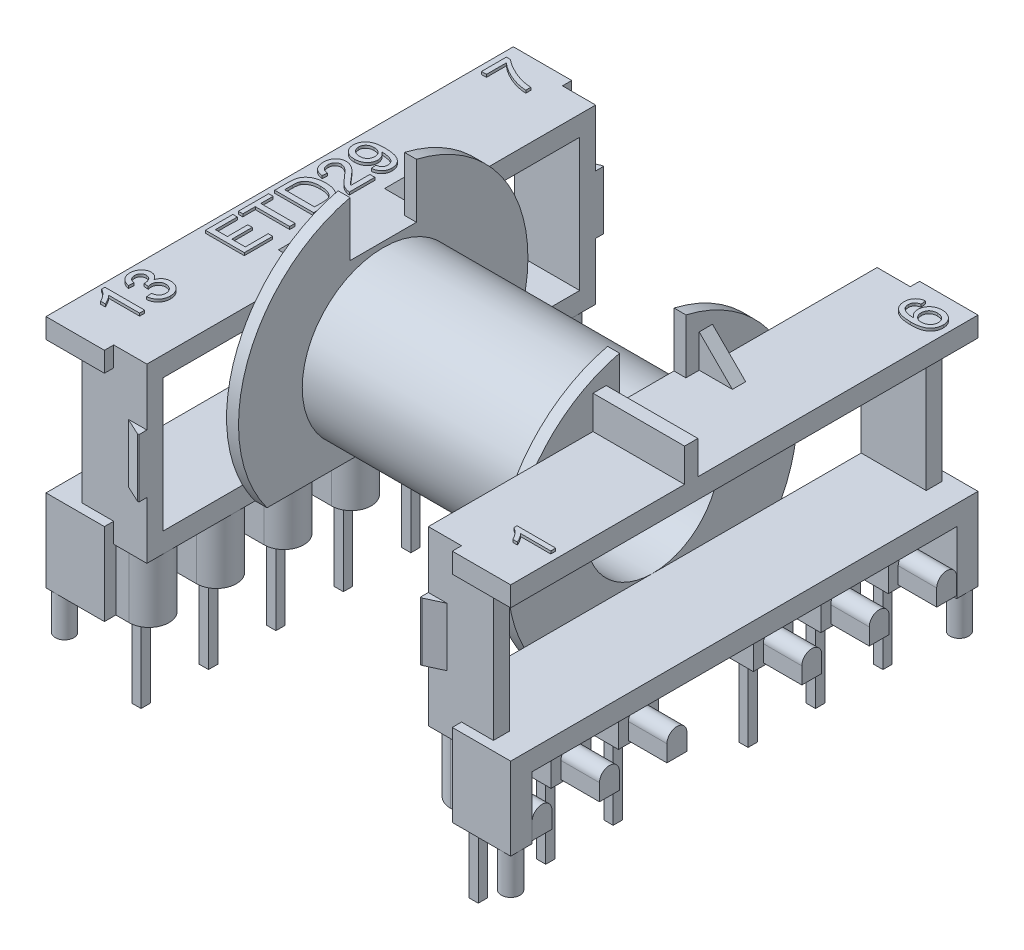
from build123d import *

# Parameters (mm, degrees)
BOSS_EXTRUDE1_DEPTH       = 6.9
SKETCH3_W                 = 17.6
SKETCH3_H                 = 1.5
BOSS_EXTRUDE2_DEPTH       = 4.4
SKETCH21_W                = 4.4
SKETCH21_H                = 1.6
BOSS_EXTRUDE17_DEPTH      = 4.7
SKETCH4_R                 = 0.7
BOSS_EXTRUDE3_DEPTH       = 2.9
SKETCH5_W                 = 1.4
SKETCH5_H                 = 4.4
BOSS_EXTRUDE4_DEPTH       = 0.6
CHAMFER1_SIZE2            = 1.286704152
CHAMFER1_SIZE             = 0.6
CHAMFER1_OF_MIRROR1_SIZE2 = 1.286704152
CHAMFER1_OF_MIRROR1_SIZE  = 0.6
CUT_EXTRUDE1_DEPTH        = 31.951736623
BOSS_EXTRUDE18_DEPTH      = 4.7
SKETCH23_W                = 0.7
SKETCH23_H                = 0.7
PIN_DEPTH                 = 6.3
BOSS_EXTRUDE20_DEPTH      = 2.9
LPATTERN1_COUNT           = 7
LPATTERN1_PITCH           = 5.08
SKETCH11_W                = 1
SKETCH11_H                = 2.5
BOSS_EXTRUDE9_DEPTH       = 2.5
CHAMFER3_SIZE             = 2.5
SKETCH12_W                = 1
SKETCH12_H                = 2.5
BOSS_EXTRUDE10_DEPTH      = 6.9
NO1_DEPTH                 = 0.2
NO6_DEPTH                 = 0.2
NO13_DEPTH                = 0.2
NO7_DEPTH                 = 0.2
ETD29_DEPTH               = 0.2
SKETCH19_W                = 2
SKETCH19_H                = 10
CUT_EXTRUDE2_DEPTH        = 25
SKETCH25_W                = 4.7
SKETCH25_H                = 11.1
CUT_EXTRUDE3_DEPTH        = 18


# Read off the part's stored shape, not the designer's step: Mirror2
with BuildPart() as part:
    # Sketch1 → Base-Revolve (revolve)
    with BuildSketch(Plane.ZX, mode=Mode.PRIVATE) as base_revolve_sk:
        Polygon((6.1, -9.7), (6.1, 9.7), (10.9, 9.7), (10.9, 10.6), (5, 10.6), (5, -10.6), (10.9, -10.6), (10.9, -9.7), align=None)
    revolve(base_revolve_sk.sketch.rotate(Axis((25, 0, 0), (-1, 0, 0)), 180), axis=Axis((25, 0, 0), (-1, 0, 0)))

    # Sketch2 → Boss-Extrude1 (add)
    with BuildSketch(Plane.ZY.offset(-10.6)):
        Polygon((0, -6.5), (0, -5), (-15.7, -5), (-15.7, 5), (0, 5), (0, 6.5), (-16.9, 6.5), (-16.9, -6.5), align=None)
    boss_extrude1 = extrude(amount=-BOSS_EXTRUDE1_DEPTH)

    # Sketch3 → Boss-Extrude2 (add)
    with BuildSketch(Plane(origin=(17.5, 0, 0), x_dir=(0, 0, -1), z_dir=(1, 0, 0))):
        with Locations((8.8, 5.75)):
            Rectangle(SKETCH3_W, SKETCH3_H)
        with Locations((8.8, -5.75)):
            Rectangle(SKETCH3_W, SKETCH3_H)
    boss_extrude2 = extrude(amount=-BOSS_EXTRUDE2_DEPTH)

    # Sketch21 → Boss-Extrude17 (add)
    with BuildSketch(Plane.XZ.offset(6.5)):
        with Locations((15.3, -16.8)):
            Rectangle(SKETCH21_W, SKETCH21_H)
    boss_extrude17 = extrude(amount=BOSS_EXTRUDE17_DEPTH)

    # Sketch4 → Boss-Extrude3 (add)
    with BuildSketch(Plane.XZ.offset(11.2)):
        with Locations(Location((16.8, -16.9, 0), (0, 0, 270))):
            Circle(SKETCH4_R)
    boss_extrude3 = extrude(amount=BOSS_EXTRUDE3_DEPTH)

    # Sketch5 → Boss-Extrude4 (add)
    with BuildSketch(Plane(origin=(0, 0, -16.9), x_dir=(-1, 0, 0), z_dir=(0, 0, -1))):
        with Locations((-11.3, 0)):
            Rectangle(SKETCH5_W, SKETCH5_H)
    boss_extrude4 = extrude(amount=BOSS_EXTRUDE4_DEPTH)

    # Chamfer1
    chamfer1_edges = [part.edges().sort_by_distance(p)[0] for p in [
        (12, 0, -17.5),
    ]]
    chamfer1_side = [part.faces().sort_by_distance(p)[0] for p in [
        (12, 0, -17.488),
    ]]
    chamfer(chamfer1_edges, length=CHAMFER1_SIZE - 0.0001, length2=CHAMFER1_SIZE2 - 0.0001, reference=chamfer1_side[0])  # a hair under: the kernel refuses the full size

    # Mirror1: Boss-Extrude1, Boss-Extrude2, Boss-Extrude17, Boss-Extrude3, Boss-Extrude4 across plane
    add(boss_extrude1.mirror(Plane.XY))
    add(boss_extrude2.mirror(Plane.XY))
    add(boss_extrude17.mirror(Plane.XY))
    add(boss_extrude3.mirror(Plane.XY))
    add(boss_extrude4.mirror(Plane.XY))

    # Chamfer1 of Mirror1
    chamfer1_of_mirror1_edges = [part.edges().sort_by_distance(p)[0] for p in [
        (12, 0, 17.5),
    ]]
    chamfer1_of_mirror1_side = [part.faces().sort_by_distance(p)[0] for p in [
        (12, 0, 17.488),
    ]]
    chamfer(chamfer1_of_mirror1_edges, length=CHAMFER1_OF_MIRROR1_SIZE - 0.0001, length2=CHAMFER1_OF_MIRROR1_SIZE2 - 0.0001, reference=chamfer1_of_mirror1_side[0])  # a hair under: the kernel refuses the full size

    # Sketch6 → Cut-Extrude1 (cut, through all)
    with BuildSketch(Plane(origin=(10.6, 0, 0), x_dir=(0, 0, -1), z_dir=(1, 0, 0))):
        with BuildLine():
            Line((-2.5, 10.609429768), (-2.5, 6.5))
            Line((-2.5, 6.5), (2.5, 6.5))
            Line((2.5, 6.5), (2.5, 10.609429768))
            ThreePointArc((2.5, 10.609429768), (0, 10.9), (-2.5, 10.609429768))
        make_face()
        with BuildLine():
            Line((8.749857142, -6.5), (-8.749857142, -6.5))
            ThreePointArc((-8.749857142, -6.5), (0, -10.9), (8.749857142, -6.5))
        make_face()
    extrude(amount=-CUT_EXTRUDE1_DEPTH, mode=Mode.SUBTRACT)

    # Sketch22 → Boss-Extrude18 (add)
    with BuildSketch(Plane.XZ.offset(6.5)):
        with BuildLine():
            Line((12.1, 13.74), (14.6, 13.74))
            Line((14.6, 13.74), (14.6, 16.74))
            Line((14.6, 16.74), (12.1, 16.74))
            ThreePointArc((12.1, 16.74), (10.6, 15.24), (12.1, 13.74))
        make_face()
    boss_extrude18 = extrude(amount=BOSS_EXTRUDE18_DEPTH)

    # Sketch23 → Pin (add)
    with BuildSketch(Plane.XZ.offset(11.2)):
        with Locations((12.7, 15.24)):
            Rectangle(SKETCH23_W, SKETCH23_H)
    pin = extrude(amount=PIN_DEPTH)

    # Sketch24 → Boss-Extrude20 (add)
    with BuildSketch(Plane(origin=(14.6, 0, 0), x_dir=(0, 0, -1), z_dir=(1, 0, 0))):
        with BuildLine():
            Line((-15.99, -11), (-14.49, -11))
            Line((-14.49, -11), (-14.49, -9.75))
            ThreePointArc((-14.49, -9.75), (-15.24, -9), (-15.99, -9.75))
            Line((-15.99, -9.75), (-15.99, -11))
        make_face()
    boss_extrude20 = extrude(amount=BOSS_EXTRUDE20_DEPTH)

    # LPattern1: Boss-Extrude18, Pin, Boss-Extrude20 ×7
    with Locations(*[(0, 0, -i * LPATTERN1_PITCH) for i in range(1, LPATTERN1_COUNT)]):
        add(boss_extrude18)
        add(pin)
        add(boss_extrude20)

    # Sketch11 → Boss-Extrude9 (add)
    with BuildSketch(Plane(origin=(10.6, 0, 0), x_dir=(0, 0, -1), z_dir=(1, 0, 0))):
        with Locations((-4, 7.75)):
            Rectangle(SKETCH11_W, SKETCH11_H)
        with Locations((4, 7.75)):
            Rectangle(SKETCH11_W, SKETCH11_H)
    extrude(amount=BOSS_EXTRUDE9_DEPTH)

    # Chamfer3
    chamfer3_edges = [part.edges().sort_by_distance(p)[0] for p in [
        (13.1, 9, -4),
        (13.1, 9, 4),
    ]]
    chamfer(chamfer3_edges, length=CHAMFER3_SIZE - 0.0001)  # a hair under: the kernel refuses the full size

    # Mirror2: part across plane


with BuildPart() as part_1:
    add(part.part)
    add(part.part.mirror(Plane(origin=(0, 0, 0), x_dir=(0, 0, 1), z_dir=(1, 0, 0))))

    # Sketch12 → Boss-Extrude10 (add)
    with BuildSketch(Plane(origin=(10.6, 0, 0), x_dir=(0, 0, -1), z_dir=(1, 0, 0))):
        with Locations((-4, 7.75)):
            Rectangle(SKETCH12_W, SKETCH12_H)
    extrude(amount=BOSS_EXTRUDE10_DEPTH)

    # Sketch13 → No1 (add)
    with BuildSketch(Plane(origin=(32, 6.5, -1), x_dir=(0, 0, -1), z_dir=(0, 1, 0))):
        with BuildLine():
            Line((-14.705735602, 15), (-15.079301701, 15))
            Line((-15.079301701, 15), (-15.079301701, 17.270581449))
            add(Edge.make_bspline(
                [(-15.079301701, 17.270581449), (-15.10081167, 17.24983773), (-15.145517784, 17.206724184), (-15.221088746, 17.14570775), (-15.305435597, 17.083865008), (-15.397463041, 17.024396298), (-15.491269451, 16.968412921), (-15.581921269, 16.91806448), (-15.667905025, 16.875457483), (-15.724542989, 16.852159809), (-15.751720681, 16.840980434)],
                knots=[0, 0, 0, 0, 0.893362401, 1.856755847, 2.901947673, 4.020460078, 5.132200827, 6.168787962, 7.121294059, 8, 8, 8, 8], degree=3))
            Line((-15.751720681, 16.840980434), (-15.751720681, 17.185361682))
            add(Edge.make_bspline(
                [(-15.751720681, 17.185361682), (-15.705040187, 17.20940223), (-15.613035698, 17.256784726), (-15.483053251, 17.33862081), (-15.361700653, 17.427334494), (-15.250986772, 17.522906137), (-15.151738833, 17.620597512), (-15.068101153, 17.719171947), (-14.998118465, 17.815016128), (-14.963006824, 17.881856816), (-14.946218778, 17.913815576)],
                knots=[0, 0, 0, 0, 1.141258006, 2.249351951, 3.335817539, 4.406819942, 5.426913362, 6.360259544, 7.215985427, 8, 8, 8, 8], degree=3))
            Line((-14.946218778, 17.913815576), (-14.705735602, 17.913815576))
            Line((-14.705735602, 17.913815576), (-14.705735602, 15))
        make_face()
    extrude(amount=NO1_DEPTH)

    # Sketch14 → No6 (add)
    with BuildSketch(Plane(origin=(6, 6.5, -31), x_dir=(0, 0, -1), z_dir=(0, 1, 0))):
        with BuildLine():
            Line((-14.656371262, -8.804991356), (-15.034821028, -8.842836332))
            add(Edge.make_bspline(
                [(-15.034821028, -8.842836332), (-15.04298767, -8.810287633), (-15.058360116, -8.749019717), (-15.09059599, -8.665919031), (-15.126119237, -8.595629985), (-15.156981217, -8.557781274), (-15.171417741, -8.540076519)],
                knots=[0, 0, 0, 0, 1.199207122, 2.257322842, 3.184815751, 4, 4, 4, 4], degree=3))
            add(Edge.make_bspline(
                [(-15.171417741, -8.540076519), (-15.183809818, -8.528000904), (-15.208182164, -8.504250964), (-15.248192685, -8.473292748), (-15.290370398, -8.447063394), (-15.334842779, -8.425813641), (-15.381369569, -8.409027556), (-15.430143492, -8.397284795), (-15.481054055, -8.39001536), (-15.515743245, -8.389139938), (-15.53331033, -8.388696613)],
                knots=[0, 0, 0, 0, 1.028360939, 2.022547923, 3.001693811, 3.976902288, 4.948369586, 5.937776631, 6.955661634, 8, 8, 8, 8], degree=3))
            add(Edge.make_bspline(
                [(-15.53331033, -8.388696613), (-15.561789596, -8.38961361), (-15.618063383, -8.391425556), (-15.700627087, -8.409164371), (-15.780819651, -8.435713338), (-15.830501908, -8.462626189), (-15.855583959, -8.476213121)],
                knots=[0, 0, 0, 0, 1.010336883, 1.996381556, 2.988474728, 4, 4, 4, 4], degree=3))
            add(Edge.make_bspline(
                [(-15.855583959, -8.476213121), (-15.880250599, -8.49665007), (-15.930885311, -8.538602237), (-15.996964233, -8.616121053), (-16.056057743, -8.706376104), (-16.099640272, -8.790636069), (-16.13031227, -8.866182536), (-16.15014925, -8.930928157), (-16.167097482, -9.002458747), (-16.181216316, -9.08063953), (-16.192136325, -9.165533923), (-16.201263266, -9.257195845), (-16.206311239, -9.355857703), (-16.207435557, -9.423909454), (-16.208015304, -9.458999858)],
                knots=[0, 0, 0, 0, 1.063306303, 2.18271343, 3.369442992, 4.644240368, 5.329284104, 6.077448525, 6.892756613, 7.771869145, 8.717113863, 9.73749892, 10.833357348, 12, 12, 12, 12], degree=3))
            add(Edge.make_bspline(
                [(-16.208015304, -9.458999858), (-16.18570318, -9.427651992), (-16.142025836, -9.366286631), (-16.0649757, -9.286016185), (-15.98084051, -9.218162184), (-15.889526201, -9.163985311), (-15.793415446, -9.121996891), (-15.694627607, -9.091782446), (-15.593335819, -9.073236019), (-15.525108986, -9.071021778), (-15.490734731, -9.069906192)],
                knots=[0, 0, 0, 0, 1.083917396, 2.121834425, 3.126226247, 4.123362703, 5.106535049, 6.077135049, 7.031216202, 8, 8, 8, 8], degree=3))
            add(Edge.make_bspline(
                [(-15.490734731, -9.069906192), (-15.461130074, -9.070702712), (-15.402640445, -9.072276389), (-15.316507841, -9.084747048), (-15.233932064, -9.106559089), (-15.154197506, -9.134974282), (-15.078836413, -9.173772302), (-15.006009541, -9.219115763), (-14.937403567, -9.274293554), (-14.872150211, -9.336292091), (-14.812739569, -9.405220675), (-14.760156937, -9.479407459), (-14.716337955, -9.559030262), (-14.680805828, -9.643555841), (-14.652995729, -9.732676624), (-14.63278839, -9.82664569), (-14.620959283, -9.925648763), (-14.619348151, -9.993331227), (-14.618526285, -10.027857163)],
                knots=[0, 0, 0, 0, 0.981553735, 1.939246043, 2.877808487, 3.810434071, 4.740031046, 5.683044261, 6.650811044, 7.654063953, 8.664382933, 9.663624521, 10.66421212, 11.671863278, 12.699354266, 13.755775259, 14.855184124, 16, 16, 16, 16], degree=3))
            add(Edge.make_bspline(
                [(-14.618526285, -10.027857163), (-14.619998776, -10.073485852), (-14.6229047, -10.163532976), (-14.646229292, -10.296139402), (-14.683813403, -10.423959179), (-14.728773513, -10.525181362), (-14.770080118, -10.60272837), (-14.805154258, -10.656968188), (-14.842658407, -10.707939954), (-14.881882169, -10.756345075), (-14.925670473, -10.799968136), (-14.971368624, -10.840864629), (-15.020487116, -10.877620652), (-15.071581322, -10.911459198), (-15.125616447, -10.940800669), (-15.181020214, -10.966873737), (-15.238248698, -10.989083195), (-15.297486686, -11.006521369), (-15.358430791, -11.020948324), (-15.42128386, -11.030868187), (-15.485880476, -11.036986018), (-15.529551434, -11.03755644), (-15.55164149, -11.037844977)],
                knots=[0, 0, 0, 0, 1.777979151, 3.508799182, 5.232661887, 6.960203328, 7.816385973, 8.656273476, 9.47551652, 10.283326439, 11.082130802, 11.882412381, 12.672407567, 13.471692325, 14.269609044, 15.067192643, 15.857822979, 16.66013129, 17.472860815, 18.297850482, 19.139002666, 20, 20, 20, 20], degree=3))
            add(Edge.make_bspline(
                [(-15.55164149, -11.037844977), (-15.588947463, -11.036810462), (-15.662111035, -11.034781597), (-15.769196625, -11.019194938), (-15.870879076, -10.993147441), (-15.967374683, -10.956730095), (-16.058977403, -10.910753943), (-16.144784509, -10.853119667), (-16.225270798, -10.785536212), (-16.300498318, -10.70761162), (-16.368707044, -10.617632154), (-16.427001294, -10.51376824), (-16.47667317, -10.396929045), (-16.517325277, -10.266793109), (-16.548087187, -10.123224341), (-16.57023706, -9.966531083), (-16.583858985, -9.796690891), (-16.585576067, -9.679000268), (-16.58646507, -9.618067025)],
                knots=[0, 0, 0, 0, 0.898506621, 1.76212948, 2.600594211, 3.422599815, 4.24233914, 5.064166416, 5.906856258, 6.769969817, 7.668413694, 8.619051846, 9.63165591, 10.722000005, 11.898403521, 13.164960021, 14.532183992, 16, 16, 16, 16], degree=3))
            add(Edge.make_bspline(
                [(-16.58646507, -9.618067025), (-16.586317661, -9.583369672), (-16.58602692, -9.514934631), (-16.581354966, -9.414215309), (-16.575995658, -9.316946457), (-16.56681333, -9.223516135), (-16.55597141, -9.133504123), (-16.541421697, -9.047439758), (-16.525797059, -8.964654083), (-16.506800687, -8.885798892), (-16.485624377, -8.810132362), (-16.461249706, -8.738485906), (-16.435504017, -8.669932543), (-16.406296067, -8.605553702), (-16.375167197, -8.544300871), (-16.340758789, -8.487307552), (-16.304673717, -8.433270574), (-16.278034217, -8.399949678), (-16.264782769, -8.383374663)],
                knots=[0, 0, 0, 0, 1.28053818, 2.525659045, 3.721026795, 4.875695215, 5.990149104, 7.066600796, 8.096771069, 9.099076143, 10.059445332, 10.995815448, 11.891625124, 12.761078582, 13.603822678, 14.426062074, 15.217066536, 16, 16, 16, 16], degree=3))
            add(Edge.make_bspline(
                [(-16.264782769, -8.383374663), (-16.240943653, -8.356560353), (-16.193954541, -8.303706858), (-16.113570945, -8.235432663), (-16.027915452, -8.177115997), (-15.93562196, -8.130001178), (-15.837395874, -8.093268954), (-15.733175616, -8.066604613), (-15.622670361, -8.051141137), (-15.547156808, -8.049124736), (-15.508474564, -8.048091823)],
                knots=[0, 0, 0, 0, 1.005002357, 1.980952959, 2.948226316, 3.90482984, 4.879026092, 5.883055346, 6.915583142, 8, 8, 8, 8], degree=3))
            add(Edge.make_bspline(
                [(-15.508474564, -8.048091823), (-15.479671339, -8.048600975), (-15.423085082, -8.049601245), (-15.340171774, -8.05919894), (-15.261306648, -8.075240045), (-15.186314051, -8.096877704), (-15.115630045, -8.125680191), (-15.048439728, -8.159814256), (-14.985425364, -8.20087539), (-14.927043144, -8.248302609), (-14.873148458, -8.300751478), (-14.824875737, -8.358662438), (-14.782406869, -8.421313719), (-14.745409745, -8.488835622), (-14.714214965, -8.56090852), (-14.6886025, -8.637842174), (-14.669135318, -8.719616814), (-14.660684923, -8.776138705), (-14.656371262, -8.804991356)],
                knots=[0, 0, 0, 0, 1.095988384, 2.15315746, 3.171326302, 4.156539379, 5.119213808, 6.072133135, 7.021027441, 7.975952916, 8.930907862, 9.879001051, 10.840359051, 11.807350428, 12.805278655, 13.825435679, 14.889953203, 16, 16, 16, 16], degree=3))
        make_face()
        with BuildLine():
            add(Edge.make_bspline(
                [(-16.208015304, -10.020169902), (-16.206962661, -10.049802346), (-16.204871194, -10.108678217), (-16.188873859, -10.196069349), (-16.16274908, -10.28133533), (-16.126944773, -10.363529204), (-16.082733048, -10.439895648), (-16.030219825, -10.507561589), (-15.970544954, -10.56553352), (-15.904029142, -10.613937241), (-15.830828521, -10.651134166), (-15.752254131, -10.67807441), (-15.668212097, -10.694357183), (-15.610256095, -10.69626467), (-15.580616551, -10.697240187)],
                knots=[0, 0, 0, 0, 1.034121613, 2.054667162, 3.090870403, 4.141799978, 5.178094622, 6.163726224, 7.122467907, 8.07367165, 9.024701118, 9.977919151, 10.965878387, 12, 12, 12, 12], degree=3))
            add(Edge.make_bspline(
                [(-15.580616551, -10.697240187), (-15.559495006, -10.696668955), (-15.518267617, -10.695553962), (-15.457904026, -10.686913883), (-15.40031049, -10.673628011), (-15.345820491, -10.653998225), (-15.294507979, -10.62894522), (-15.246106523, -10.598454068), (-15.200647423, -10.562433481), (-15.158680316, -10.520949578), (-15.120751132, -10.474812023), (-15.0877957, -10.424303938), (-15.058692975, -10.370256312), (-15.036803079, -10.311340946), (-15.018965984, -10.249067193), (-15.005852313, -10.182846236), (-14.998153208, -10.112602043), (-14.99737412, -10.06434183), (-14.996976052, -10.039683718)],
                knots=[0, 0, 0, 0, 1.023436885, 1.997658284, 2.950132304, 3.883974581, 4.798406504, 5.712938251, 6.651509614, 7.604127386, 8.56812849, 9.540661787, 10.523651728, 11.536824179, 12.580180944, 13.661349568, 14.805088061, 16, 16, 16, 16], degree=3))
            add(Edge.make_bspline(
                [(-14.996976052, -10.039683718), (-14.997345254, -10.016004892), (-14.998067276, -9.969697959), (-15.006191519, -9.902126304), (-15.018026593, -9.838247132), (-15.036194806, -9.778597946), (-15.058493176, -9.722547259), (-15.086432791, -9.670514345), (-15.118987722, -9.622056974), (-15.157157039, -9.578458272), (-15.198897917, -9.538737292), (-15.244740449, -9.504235829), (-15.294134463, -9.475097472), (-15.347258148, -9.451242816), (-15.404211572, -9.432961029), (-15.464876802, -9.420291305), (-15.52891249, -9.411447284), (-15.5728976, -9.410827867), (-15.595399745, -9.410510982)],
                knots=[0, 0, 0, 0, 1.155658139, 2.260035327, 3.319019312, 4.323913291, 5.299809325, 6.260058621, 7.202437855, 8.144128683, 9.083751266, 10.011616631, 10.939332216, 11.87851101, 12.849505762, 13.853846437, 14.90205895, 16, 16, 16, 16], degree=3))
            add(Edge.make_bspline(
                [(-15.595399745, -9.410510982), (-15.616326771, -9.410837951), (-15.657565466, -9.411482276), (-15.718042361, -9.420395306), (-15.776329809, -9.433090421), (-15.832195089, -9.451560027), (-15.88565742, -9.475345362), (-15.936704946, -9.504277396), (-15.984894369, -9.539184949), (-16.030665096, -9.578277394), (-16.072430332, -9.621703706), (-16.109073213, -9.668685813), (-16.13896068, -9.719525973), (-16.165087177, -9.772980428), (-16.184229152, -9.830309257), (-16.197848908, -9.890743856), (-16.206292809, -9.954295381), (-16.207432206, -9.997870095), (-16.208015304, -10.020169902)],
                knots=[0, 0, 0, 0, 1.036988316, 2.04348404, 3.025371103, 3.992992706, 4.955812186, 5.923433788, 6.897355974, 7.902569022, 8.905116476, 9.880852345, 10.849905012, 11.825004025, 12.826645469, 13.839294292, 14.894236693, 16, 16, 16, 16], degree=3))
        make_face(mode=Mode.SUBTRACT)
    extrude(amount=NO6_DEPTH)

    # Sketch15 → No13 (add)
    with BuildSketch(Plane(origin=(-3, 6.5, 35), x_dir=(0, 0, -1), z_dir=(0, 1, 0))):
        with BuildLine():
            Line((21.334539489, 11), (20.950904617, 11))
            Line((20.950904617, 11), (20.950904617, 13.331780708))
            add(Edge.make_bspline(
                [(20.950904617, 13.331780708), (20.928814887, 13.310477881), (20.882903804, 13.26620229), (20.805295969, 13.203541273), (20.718675706, 13.140031676), (20.624167836, 13.078960099), (20.52783305, 13.021467795), (20.434737882, 12.969762306), (20.346436596, 12.926006918), (20.288272062, 12.902081298), (20.260361847, 12.890600605)],
                knots=[0, 0, 0, 0, 0.893362401, 1.856755847, 2.901947673, 4.020460078, 5.132200827, 6.168787962, 7.121294059, 8, 8, 8, 8], degree=3))
            Line((20.260361847, 12.890600605), (20.260361847, 13.244264003))
            add(Edge.make_bspline(
                [(20.260361847, 13.244264003), (20.308300525, 13.268952518), (20.402784822, 13.31761212), (20.536270703, 13.401653942), (20.660894131, 13.492758737), (20.774592097, 13.590906334), (20.876515078, 13.691230797), (20.962407055, 13.79246212), (21.034275995, 13.890889602), (21.070334004, 13.959531854), (21.08757454, 13.992352003)],
                knots=[0, 0, 0, 0, 1.141258006, 2.249351951, 3.335817539, 4.406819942, 5.426913362, 6.360259544, 7.215985427, 8, 8, 8, 8], degree=3))
            Line((21.08757454, 13.992352003), (21.334539489, 13.992352003))
            Line((21.334539489, 13.992352003), (21.334539489, 11))
        make_face()
        with BuildLine():
            Line((22.29362667, 11.805633232), (22.677261542, 11.843996719))
            add(Edge.make_bspline(
                [(22.677261542, 11.843996719), (22.682375854, 11.820945664), (22.692271669, 11.776343582), (22.711312426, 11.712446466), (22.731423646, 11.653135654), (22.756355408, 11.599737787), (22.78068339, 11.550069113), (22.809272452, 11.506181895), (22.839820419, 11.466931057), (22.872892022, 11.432462346), (22.908868351, 11.402780577), (22.947269762, 11.376807428), (22.98890841, 11.355116351), (23.033465498, 11.337942305), (23.080565749, 11.324039769), (23.130465129, 11.313831388), (23.183427499, 11.307750129), (23.219728904, 11.307193223), (23.238327542, 11.306907898)],
                knots=[0, 0, 0, 0, 1.321063709, 2.556160278, 3.730472002, 4.821700466, 5.852032229, 6.822994757, 7.746964065, 8.632786469, 9.490489437, 10.352773447, 11.223141997, 12.11199479, 13.021433979, 13.96892724, 14.959401504, 16, 16, 16, 16], degree=3))
            add(Edge.make_bspline(
                [(23.238327542, 11.306907898), (23.260143085, 11.307218934), (23.302748877, 11.30782639), (23.364832542, 11.316940541), (23.423916099, 11.329455139), (23.479156579, 11.349078744), (23.531323178, 11.373062418), (23.580118698, 11.402701151), (23.625877144, 11.437504441), (23.667695961, 11.477709022), (23.705094426, 11.521935343), (23.738403013, 11.568649624), (23.76594474, 11.618250467), (23.789158268, 11.670039227), (23.806292888, 11.724852787), (23.818836813, 11.782007649), (23.827034332, 11.841762292), (23.827783705, 11.88253256), (23.828166159, 11.903340238)],
                knots=[0, 0, 0, 0, 1.111377895, 2.170522867, 3.193923215, 4.186422864, 5.152846954, 6.117443035, 7.091571248, 8.078879332, 9.069127402, 10.041602243, 10.999610288, 11.957618333, 12.930786866, 13.922135183, 14.939532534, 16, 16, 16, 16], degree=3))
            add(Edge.make_bspline(
                [(23.828166159, 11.903340238), (23.827716664, 11.923141922), (23.826837263, 11.961882338), (23.819607877, 12.018744956), (23.806992759, 12.072722918), (23.78950519, 12.124128613), (23.767159665, 12.172886575), (23.740301003, 12.219399986), (23.707450657, 12.262649502), (23.670474696, 12.303099662), (23.63014471, 12.340365865), (23.586009735, 12.372065567), (23.539563153, 12.399423443), (23.490251429, 12.421513858), (23.438279307, 12.439047147), (23.383696331, 12.451648666), (23.326240079, 12.458881189), (23.287101593, 12.459760743), (23.267100158, 12.460210232)],
                knots=[0, 0, 0, 0, 1.072815875, 2.098878726, 3.09954706, 4.07199174, 5.036203424, 6.001873089, 6.97636515, 7.972747947, 8.969130744, 9.945905975, 10.911575641, 11.885646534, 12.868345115, 13.879560892, 14.916365174, 16, 16, 16, 16], degree=3))
            add(Edge.make_bspline(
                [(23.267100158, 12.460210232), (23.249490109, 12.459743687), (23.212117479, 12.458753568), (23.153130963, 12.450011195), (23.087793405, 12.437769823), (23.042643288, 12.425756732), (23.01893635, 12.419449027)],
                knots=[0, 0, 0, 0, 0.837610211, 1.777604146, 2.833088267, 4, 4, 4, 4], degree=3))
            Line((23.01893635, 12.419449027), (23.058498696, 12.764720412))
            add(Edge.make_bspline(
                [(23.058498696, 12.764720412), (23.06887893, 12.763586136), (23.087217232, 12.761582261), (23.105648011, 12.760844544), (23.113646209, 12.760524406)],
                knots=[0, 0, 0, 0, 1.132082448, 2, 2, 2, 2], degree=3))
            add(Edge.make_bspline(
                [(23.113646209, 12.760524406), (23.148927913, 12.761871448), (23.218139526, 12.76451392), (23.319036641, 12.786470656), (23.414657514, 12.821040826), (23.488530815, 12.862288055), (23.543312759, 12.901083315), (23.577857152, 12.936062744), (23.609000703, 12.973182985), (23.632236339, 13.015761246), (23.652310494, 13.061001676), (23.664741369, 13.110686417), (23.67380698, 13.163607761), (23.674405049, 13.200262522), (23.67471221, 13.219087964)],
                knots=[0, 0, 0, 0, 1.557468908, 3.055264441, 4.54122591, 6.035034992, 6.780215604, 7.498173296, 8.201377046, 8.913174237, 9.633083494, 10.382644491, 11.169345745, 12, 12, 12, 12], degree=3))
            add(Edge.make_bspline(
                [(23.67471221, 13.219087964), (23.674428723, 13.234293909), (23.673874302, 13.264032447), (23.667697807, 13.307632283), (23.657482643, 13.348944471), (23.643675832, 13.388410111), (23.625580635, 13.425822369), (23.603141171, 13.461135446), (23.577503322, 13.495065695), (23.547238748, 13.525859823), (23.514828015, 13.554770936), (23.479089237, 13.579120023), (23.441723312, 13.600750607), (23.40141243, 13.61709583), (23.35915177, 13.630534268), (23.314580084, 13.639951381), (23.267681103, 13.646275604), (23.23555193, 13.646808504), (23.219145799, 13.647080618)],
                knots=[0, 0, 0, 0, 1.041493611, 2.036867705, 3.009952345, 3.954088258, 4.897230656, 5.850851638, 6.817653571, 7.805463921, 8.805067469, 9.788883576, 10.763797054, 11.758134544, 12.762883247, 13.799594994, 14.876406454, 16, 16, 16, 16], degree=3))
            add(Edge.make_bspline(
                [(23.219145799, 13.647080618), (23.187039415, 13.645828738), (23.125037231, 13.64341117), (23.036267725, 13.621043657), (22.955826525, 13.584850109), (22.896271739, 13.542405183), (22.853982604, 13.501825432), (22.825096885, 13.467429413), (22.799260246, 13.429446178), (22.776399462, 13.387889265), (22.756823388, 13.342591547), (22.7391761, 13.294114196), (22.725515463, 13.241681089), (22.718977727, 13.205350115), (22.715625029, 13.186718772)],
                knots=[0, 0, 0, 0, 1.533565899, 2.961543033, 4.347411787, 5.731829577, 6.434842101, 7.147085226, 7.87612511, 8.629021686, 9.412189982, 10.234506416, 11.094615066, 12, 12, 12, 12], degree=3))
            Line((22.715625029, 13.186718772), (22.331990157, 13.225082259))
            add(Edge.make_bspline(
                [(22.331990157, 13.225082259), (22.337991351, 13.254745325), (22.349763167, 13.312931763), (22.373746189, 13.396968836), (22.402993187, 13.475855716), (22.438109124, 13.549230724), (22.477435009, 13.617971984), (22.522800271, 13.681264118), (22.573141321, 13.739483408), (22.628547576, 13.792452275), (22.688266866, 13.839759398), (22.751998399, 13.880567998), (22.819219156, 13.915159168), (22.889992071, 13.943045771), (22.96426111, 13.965721805), (23.042237565, 13.980744733), (23.123568486, 13.990906987), (23.178951529, 13.991864406), (23.207157209, 13.992352003)],
                knots=[0, 0, 0, 0, 1.136581168, 2.229493434, 3.279335563, 4.293305329, 5.282068175, 6.250623624, 7.213783178, 8.169396253, 9.125981663, 10.071280146, 11.007896369, 11.961295906, 12.925420184, 13.920544621, 14.940967302, 16, 16, 16, 16], degree=3))
            add(Edge.make_bspline(
                [(23.207157209, 13.992352003), (23.246200585, 13.991085923), (23.322972485, 13.988596399), (23.435732515, 13.9688243), (23.54358689, 13.936377891), (23.645667714, 13.891401383), (23.740218739, 13.836441276), (23.823888602, 13.770574935), (23.895558752, 13.694941833), (23.953837154, 13.610368859), (23.999985473, 13.520323916), (24.034133841, 13.426853359), (24.054538004, 13.330064788), (24.057074807, 13.26453895), (24.058347082, 13.231675983)],
                knots=[0, 0, 0, 0, 1.104647871, 2.172094857, 3.229560912, 4.285649672, 5.322588163, 6.317201348, 7.289435229, 8.260615662, 9.214246199, 10.146367077, 11.070353327, 12, 12, 12, 12], degree=3))
            add(Edge.make_bspline(
                [(24.058347082, 13.231675983), (24.05705725, 13.200610722), (24.054510537, 13.139273851), (24.034903863, 13.04958848), (24.001772483, 12.964621676), (23.956991298, 12.884075329), (23.898921088, 12.809691318), (23.827721355, 12.743408385), (23.744531108, 12.684592301), (23.682187053, 12.65397918), (23.650135601, 12.63824079)],
                knots=[0, 0, 0, 0, 0.975609618, 1.926294443, 2.868398979, 3.832526731, 4.812148358, 5.820404151, 6.879456693, 8, 8, 8, 8], degree=3))
            add(Edge.make_bspline(
                [(23.650135601, 12.63824079), (23.671623961, 12.632815404), (23.713713387, 12.622188657), (23.774163348, 12.600170336), (23.830993098, 12.574392422), (23.884959004, 12.5451959), (23.934494334, 12.510666281), (23.981306529, 12.472912057), (24.023625977, 12.430114958), (24.06267875, 12.383800349), (24.098211978, 12.334452919), (24.128113538, 12.281112752), (24.153917715, 12.225182064), (24.175921064, 12.166255195), (24.191732621, 12.103877771), (24.203038384, 12.038533034), (24.210499265, 11.97044801), (24.211362856, 11.923940436), (24.211801031, 11.900343091)],
                knots=[0, 0, 0, 0, 1.053251915, 2.063013066, 3.05373318, 4.018979697, 4.975584284, 5.920798056, 6.874756953, 7.832116109, 8.799604348, 9.761196922, 10.734637845, 11.72654167, 12.747371341, 13.789206138, 14.878271633, 16, 16, 16, 16], degree=3))
            add(Edge.make_bspline(
                [(24.211801031, 11.900343091), (24.211070873, 11.868127039), (24.209635879, 11.804812159), (24.196032091, 11.711801159), (24.173800447, 11.622684118), (24.143034834, 11.537158409), (24.104049935, 11.454874987), (24.055130316, 11.376995012), (23.997725844, 11.302885424), (23.932733957, 11.233255796), (23.861529125, 11.169264025), (23.784203402, 11.11385327), (23.702286671, 11.066797583), (23.615645626, 11.028423903), (23.524509951, 10.99827546), (23.428788983, 10.976664092), (23.328186518, 10.963962869), (23.259543945, 10.96242217), (23.224540664, 10.961636513)],
                knots=[0, 0, 0, 0, 1.016055063, 1.996874249, 2.958724482, 3.910019225, 4.860394196, 5.826121543, 6.806008102, 7.814207964, 8.82789325, 9.821757317, 10.810247154, 11.803791187, 12.806673825, 13.834534493, 14.895752369, 16, 16, 16, 16], degree=3))
            add(Edge.make_bspline(
                [(23.224540664, 10.961636513), (23.193128124, 10.962228197), (23.131287506, 10.963393023), (23.040765611, 10.975528526), (22.954040929, 10.992750198), (22.871799231, 11.019299476), (22.793085208, 11.05167589), (22.719231988, 11.093096629), (22.648911635, 11.140646031), (22.583444325, 11.195682597), (22.523193633, 11.256428579), (22.46944281, 11.321985493), (22.423286611, 11.392207782), (22.382590875, 11.466044787), (22.349698195, 11.544888373), (22.324086037, 11.628061615), (22.304556421, 11.715255835), (22.297309561, 11.775179648), (22.29362667, 11.805633232)],
                knots=[0, 0, 0, 0, 1.08471039, 2.135426191, 3.150939737, 4.135689946, 5.116584603, 6.086901885, 7.055842759, 8.045878862, 9.036901429, 10.008421467, 10.96965771, 11.936653536, 12.917548193, 13.915472582, 14.940632654, 16, 16, 16, 16], degree=3))
        make_face()
    extrude(amount=NO13_DEPTH)

    # Sketch16 → No7 (add)
    with BuildSketch(Plane(origin=(-29, 6.5, 3), x_dir=(0, 0, -1), z_dir=(0, 1, 0))):
        with BuildLine():
            Line((17.587601176, -12.486144237), (17.587601176, -12.110941885))
            Line((17.587601176, -12.110941885), (19.46361294, -12.110941885))
            Line((19.46361294, -12.110941885), (19.46361294, -12.414621289))
            add(Edge.make_bspline(
                [(19.46361294, -12.414621289), (19.441527385, -12.440448498), (19.396370184, -12.493256068), (19.330950758, -12.577370048), (19.265191399, -12.666922735), (19.200247964, -12.762775267), (19.13515007, -12.864228115), (19.070159713, -12.971605296), (19.00501158, -13.084645275), (18.919556731, -13.242923279), (18.817604689, -13.445559026), (18.711666837, -13.695242734), (18.617618509, -13.947415061), (18.567570257, -14.118916481), (18.542608415, -14.204453762)],
                knots=[0, 0, 0, 0, 0.603281671, 1.233499104, 1.891379699, 2.575603978, 3.288773649, 4.031381703, 4.80386477, 5.604951941, 7.224880277, 8.828980706, 10.418436603, 12, 12, 12, 12], degree=3))
            add(Edge.make_bspline(
                [(18.542608415, -14.204453762), (18.526419601, -14.266228854), (18.493485543, -14.391902332), (18.457432892, -14.587057328), (18.429558848, -14.790535808), (18.418613224, -14.929383159), (18.413046352, -15)],
                knots=[0, 0, 0, 0, 0.948866074, 1.930345965, 2.947387709, 4, 4, 4, 4], degree=3))
            Line((18.413046352, -15), (18.037844, -15))
            add(Edge.make_bspline(
                [(18.037844, -15), (18.038743945, -14.970867395), (18.040594629, -14.910957908), (18.048778505, -14.818900605), (18.059678679, -14.722268765), (18.075074249, -14.621388831), (18.094643284, -14.516056029), (18.117962351, -14.406158789), (18.145812138, -14.291924401), (18.187000385, -14.133545917), (18.248171628, -13.934398042), (18.337232528, -13.698923943), (18.43965497, -13.467490585), (18.537409252, -13.279810393), (18.620769739, -13.133660036), (18.684028793, -13.027616681), (18.749086726, -12.926569108), (18.814737419, -12.829790407), (18.880992252, -12.737199076), (18.949200867, -12.649660596), (19.017352241, -12.565416325), (19.06493336, -12.512335232), (19.088410587, -12.486144237)],
                knots=[0, 0, 0, 0, 0.630312875, 1.296201307, 1.998242258, 2.7335219, 3.502880474, 4.315318118, 5.163159648, 6.045885937, 7.85484959, 9.666009448, 11.488277305, 13.325849397, 14.240191093, 15.127469759, 15.996293014, 16.839220888, 17.656853801, 18.458354243, 19.239329216, 20, 20, 20, 20], degree=3))
            Line((19.088410587, -12.486144237), (17.587601176, -12.486144237))
        make_face()
    extrude(amount=NO7_DEPTH)

    # Sketch27 → ETD29 (add)
    # profile 1 of 5: a face of its own
    with BuildSketch(Plane(origin=(-12.807142392, 6.5, 6.249072165), x_dir=(0, 0, -1), z_dir=(0, 1, 0))):
        Polygon((0.086850802, 1.192857608), (0.086850802, 4.120272461), (2.151053583, 4.120272461), (2.151053583, 3.782493824), (0.499691358, 3.782493824), (0.499691358, 2.881750792), (2.038460704, 2.881750792), (2.038460704, 2.543972155), (0.499691358, 2.543972155), (0.499691358, 1.530636245), (2.226115502, 1.530636245), (2.226115502, 1.192857608), align=None)
    # profile 2 of 5: a face of its own
    with BuildSketch(Plane(origin=(-12.807142392, 6.5, 6.249072165), x_dir=(0, 0, -1), z_dir=(0, 1, 0))):
        Polygon((3.50216813, 1.192857608), (3.50216813, 3.782493824), (2.563894139, 3.782493824), (2.563894139, 4.120272461), (4.853282678, 4.120272461), (4.853282678, 3.782493824), (3.915008687, 3.782493824), (3.915008687, 1.192857608), align=None)
    # profile 3 of 5: a face of its own
    with BuildSketch(Plane(origin=(-12.807142392, 6.5, 6.249072165), x_dir=(0, 0, -1), z_dir=(0, 1, 0))):
        with BuildLine():
            Line((5.303654194, 1.192857608), (5.303654194, 4.120272461))
            Line((5.303654194, 4.120272461), (6.304675258, 4.120272461))
            add(Edge.make_bspline(
                [(6.304675258, 4.120272461), (6.332041839, 4.120148829), (6.385217201, 4.119908603), (6.462459819, 4.118377542), (6.534787156, 4.114684637), (6.601865936, 4.110186191), (6.664034469, 4.104196896), (6.72121333, 4.097499374), (6.773447136, 4.088763331), (6.806287101, 4.08150205), (6.821898796, 4.078050131)],
                knots=[0, 0, 0, 0, 1.263127796, 2.454354013, 3.565393221, 4.605443485, 5.557051711, 6.447822442, 7.26211484, 8, 8, 8, 8], degree=3))
            add(Edge.make_bspline(
                [(6.821898796, 4.078050131), (6.86227333, 4.0674574), (6.941593047, 4.046646946), (7.05356117, 3.999836518), (7.15635278, 3.941121377), (7.217314676, 3.892756975), (7.24764062, 3.868697747)],
                knots=[0, 0, 0, 0, 1.04477941, 2.052571232, 3.03123721, 4, 4, 4, 4], degree=3))
            add(Edge.make_bspline(
                [(7.24764062, 3.868697747), (7.266469825, 3.852162649), (7.304213469, 3.819017604), (7.356054139, 3.764408722), (7.404145872, 3.706477573), (7.449925094, 3.64622149), (7.490463808, 3.581443694), (7.528463164, 3.514008664), (7.561607804, 3.442562213), (7.592116947, 3.368271983), (7.619298511, 3.290848413), (7.641632657, 3.210341502), (7.662150629, 3.127591935), (7.677411235, 3.041695165), (7.690732955, 2.953379779), (7.699189943, 2.862140293), (7.704677121, 2.768249074), (7.705313004, 2.704659743), (7.705635612, 2.672398408)],
                knots=[0, 0, 0, 0, 0.908997367, 1.822109427, 2.728529095, 3.640759027, 4.565643067, 5.499218265, 6.448003669, 7.421473682, 8.413047621, 9.423472075, 10.452328391, 11.505545429, 12.587978234, 13.692612971, 14.829372988, 16, 16, 16, 16], degree=3))
            add(Edge.make_bspline(
                [(7.705635612, 2.672398408), (7.704849243, 2.618409695), (7.703318988, 2.51334893), (7.688185348, 2.360540003), (7.664767326, 2.216904616), (7.630685709, 2.083305253), (7.588710639, 1.960482904), (7.542919481, 1.847434451), (7.490210605, 1.746107821), (7.43239015, 1.655646481), (7.370437065, 1.57547807), (7.305533853, 1.504399398), (7.237488122, 1.442379012), (7.166645526, 1.387789248), (7.089326821, 1.342587423), (7.006343146, 1.301999992), (6.915002243, 1.269388006), (6.817024236, 1.240861582), (6.711258326, 1.219490273), (6.598277241, 1.203785946), (6.477636959, 1.194289344), (6.394806192, 1.1933441), (6.352175379, 1.192857608)],
                knots=[0, 0, 0, 0, 1.410753827, 2.745293735, 4.009435601, 5.211453015, 6.344066657, 7.400119332, 8.396481539, 9.324811333, 10.202671465, 11.041621015, 11.837259285, 12.606727868, 13.374311266, 14.17412185, 15.017911533, 15.905707008, 16.839601966, 17.835295848, 18.885883805, 20, 20, 20, 20], degree=3))
            Line((6.352175379, 1.192857608), (5.303654194, 1.192857608))
        make_face()
        with BuildLine():
            Line((5.71649475, 1.530636245), (6.319922211, 1.530636245))
            add(Edge.make_bspline(
                [(6.319922211, 1.530636245), (6.36392264, 1.531294913), (6.447161649, 1.532540967), (6.564598746, 1.542110628), (6.667094268, 1.558617009), (6.75578478, 1.582101133), (6.832737642, 1.612469711), (6.900495013, 1.648372625), (6.960766041, 1.689114362), (6.994716719, 1.721709456), (7.011312858, 1.737642944)],
                knots=[0, 0, 0, 0, 1.423649224, 2.693227144, 3.808972214, 4.778671344, 5.656058397, 6.479437267, 7.256702014, 8, 8, 8, 8], degree=3))
            add(Edge.make_bspline(
                [(7.011312858, 1.737642944), (7.032909422, 1.762336983), (7.077276191, 1.813067034), (7.132524326, 1.901689733), (7.180703389, 2.001407239), (7.220978349, 2.113281106), (7.254002773, 2.236932934), (7.276028805, 2.373470288), (7.290429609, 2.521964779), (7.291986938, 2.625252019), (7.292795056, 2.678849041)],
                knots=[0, 0, 0, 0, 0.782184731, 1.606876467, 2.483531085, 3.422528604, 4.441347086, 5.534669947, 6.720709839, 8, 8, 8, 8], degree=3))
            add(Edge.make_bspline(
                [(7.292795056, 2.678849041), (7.292294351, 2.716190699), (7.291321002, 2.788781369), (7.285253001, 2.894533802), (7.273273876, 2.9935075), (7.257953696, 3.085873649), (7.237036392, 3.171338646), (7.213117094, 3.250721342), (7.183025797, 3.322984008), (7.148687939, 3.388684514), (7.11101891, 3.448259182), (7.071766429, 3.502987635), (7.030729621, 3.552690438), (6.98703895, 3.59666041), (6.942007807, 3.63619784), (6.894796691, 3.670493264), (6.845537716, 3.699536144), (6.810923749, 3.714612527), (6.793750576, 3.722092436)],
                knots=[0, 0, 0, 0, 1.460126857, 2.838427476, 4.139102445, 5.35666337, 6.496721546, 7.577303074, 8.594995104, 9.55219858, 10.472533725, 11.348579167, 12.184287935, 12.989560785, 13.769667798, 14.524891986, 15.268148459, 16, 16, 16, 16], degree=3))
            add(Edge.make_bspline(
                [(6.793750576, 3.722092436), (6.780332141, 3.727003003), (6.751899357, 3.737408172), (6.705494296, 3.749185259), (6.653705779, 3.760023441), (6.596023343, 3.767630432), (6.532738718, 3.775023597), (6.463458527, 3.77951627), (6.388546115, 3.781552231), (6.336734, 3.782172972), (6.30995305, 3.782493824)],
                knots=[0, 0, 0, 0, 0.699400087, 1.48198292, 2.341906832, 3.289648813, 4.329964754, 5.462247508, 6.688271602, 8, 8, 8, 8], degree=3))
            Line((6.30995305, 3.782493824), (5.71649475, 3.782493824))
            Line((5.71649475, 3.782493824), (5.71649475, 1.530636245))
        make_face(mode=Mode.SUBTRACT)
    # profile 4 of 5: a face of its own
    with BuildSketch(Plane(origin=(-12.807142392, 6.5, 6.249072165), x_dir=(0, 0, -1), z_dir=(0, 1, 0))):
        with BuildLine():
            Line((9.919962231, 1.568167204), (9.919962231, 1.192857608))
            Line((9.919962231, 1.192857608), (8.005883289, 1.192857608))
            add(Edge.make_bspline(
                [(8.005883289, 1.192857608), (8.005844103, 1.215163312), (8.005765862, 1.259699957), (8.013302179, 1.32556683), (8.025105562, 1.390559924), (8.038451642, 1.43223741), (8.045173512, 1.45322864)],
                knots=[0, 0, 0, 0, 1.01057331, 2.01775941, 3.001627217, 4, 4, 4, 4], degree=3))
            add(Edge.make_bspline(
                [(8.045173512, 1.45322864), (8.057593292, 1.487525806), (8.082882008, 1.557360483), (8.134117212, 1.658122169), (8.19438192, 1.758274469), (8.253058095, 1.839812582), (8.306792802, 1.904955833), (8.351856358, 1.955922888), (8.401795038, 2.008093675), (8.45656885, 2.061458664), (8.515650629, 2.116363478), (8.579120992, 2.172991223), (8.647729424, 2.23028658), (8.695625289, 2.268264326), (8.720144365, 2.287706071)],
                knots=[0, 0, 0, 0, 1.204657718, 2.452881516, 3.728232997, 5.065887527, 5.768225529, 6.518857853, 7.313994055, 8.154655305, 9.046094665, 9.979688118, 10.965752482, 12, 12, 12, 12], degree=3))
            add(Edge.make_bspline(
                [(8.720144365, 2.287706071), (8.757811722, 2.319410074), (8.830342607, 2.380458142), (8.932767582, 2.471047818), (9.026316125, 2.555165463), (9.109498581, 2.634285411), (9.182995295, 2.707640249), (9.24697884, 2.775063784), (9.301999748, 2.836345599), (9.347386323, 2.893703837), (9.385680369, 2.947865967), (9.418131191, 3.000697781), (9.445174645, 3.053122134), (9.467698224, 3.104973141), (9.485512461, 3.15647254), (9.497655398, 3.207770373), (9.505890318, 3.25835764), (9.506714228, 3.292018969), (9.507121675, 3.308665458)],
                knots=[0, 0, 0, 0, 1.782554561, 3.432421876, 4.950675607, 6.337395053, 7.588547463, 8.709982106, 9.702713005, 10.569305638, 11.356701089, 12.103210377, 12.812277205, 13.490692607, 14.148717897, 14.782152033, 15.397739362, 16, 16, 16, 16], degree=3))
            add(Edge.make_bspline(
                [(9.507121675, 3.308665458), (9.506714179, 3.32511772), (9.505914694, 3.357396164), (9.498329215, 3.404635464), (9.48776962, 3.450128039), (9.47069797, 3.493054923), (9.450377566, 3.534687347), (9.424311744, 3.57370978), (9.394158947, 3.61109476), (9.359636545, 3.645856623), (9.321929999, 3.678468799), (9.279798306, 3.70557744), (9.236008665, 3.729983295), (9.189050371, 3.749607001), (9.138999729, 3.764017039), (9.086221082, 3.774475016), (9.030722807, 3.781105933), (8.992849136, 3.782024179), (8.973478343, 3.782493824)],
                knots=[0, 0, 0, 0, 0.988194508, 1.938783882, 2.870742509, 3.789494954, 4.709148727, 5.651055405, 6.603531303, 7.592354411, 8.592907906, 9.593461401, 10.59787167, 11.603930315, 12.645063138, 13.723588815, 14.835711238, 16, 16, 16, 16], degree=3))
            add(Edge.make_bspline(
                [(8.973478343, 3.782493824), (8.953129863, 3.782026505), (8.913306393, 3.781111929), (8.855095145, 3.774454566), (8.799833655, 3.764283016), (8.747653823, 3.748731585), (8.698619161, 3.729140602), (8.652929374, 3.704480772), (8.609852778, 3.676644284), (8.570746023, 3.643687982), (8.535382297, 3.607146165), (8.503987541, 3.567363181), (8.478264256, 3.5235713), (8.457020906, 3.476733407), (8.439939475, 3.426702261), (8.427538937, 3.373095386), (8.42077808, 3.316067563), (8.419418529, 3.277014925), (8.418723845, 3.257060389)],
                knots=[0, 0, 0, 0, 1.131143733, 2.213731411, 3.253917892, 4.251203413, 5.236093891, 6.184197493, 7.13373276, 8.082770301, 9.020476205, 9.957489029, 10.893177274, 11.836722509, 12.812818608, 13.827831385, 14.890097571, 16, 16, 16, 16], degree=3))
            Line((8.418723845, 3.257060389), (8.043414249, 3.294591348))
            add(Edge.make_bspline(
                [(8.043414249, 3.294591348), (8.047254199, 3.327300497), (8.054724492, 3.39093333), (8.073331972, 3.48309477), (8.099455191, 3.568831327), (8.130713827, 3.649338349), (8.169899472, 3.723245363), (8.214195471, 3.792081055), (8.266440558, 3.853662243), (8.324157518, 3.909930055), (8.387978703, 3.959516803), (8.457304612, 4.002837712), (8.532103534, 4.039072978), (8.611958864, 4.069074267), (8.697053931, 4.091837), (8.787268353, 4.108160028), (8.882747211, 4.118221729), (8.948237323, 4.11957913), (8.98168824, 4.120272461)],
                knots=[0, 0, 0, 0, 1.130804643, 2.199883102, 3.223565206, 4.205909148, 5.160801384, 6.091796021, 7.01151579, 7.927798993, 8.855738875, 9.7815393, 10.730299821, 11.705391175, 12.706931101, 13.751121791, 14.851322166, 16, 16, 16, 16], degree=3))
            add(Edge.make_bspline(
                [(8.98168824, 4.120272461), (9.015539546, 4.119692795), (9.08148209, 4.118563604), (9.177570976, 4.10700971), (9.268233496, 4.089014625), (9.353802015, 4.063934987), (9.433770984, 4.031048102), (9.508201917, 3.990867754), (9.577437999, 3.943785892), (9.640322437, 3.889237328), (9.697026979, 3.829688433), (9.746720148, 3.766136925), (9.78826603, 3.698854296), (9.823639769, 3.628757657), (9.849877777, 3.554365911), (9.868328828, 3.476690426), (9.880866852, 3.395664829), (9.881902866, 3.340380879), (9.882431272, 3.312183986)],
                knots=[0, 0, 0, 0, 1.195390245, 2.328627238, 3.413424916, 4.457841177, 5.473507151, 6.462241215, 7.441013641, 8.425227782, 9.397253344, 10.342087291, 11.269524934, 12.186751184, 13.110685745, 14.048630397, 15.004728144, 16, 16, 16, 16], degree=3))
            add(Edge.make_bspline(
                [(9.882431272, 3.312183986), (9.881624404, 3.283214873), (9.880008888, 3.225212718), (9.867399572, 3.138516602), (9.845824891, 3.052761331), (9.817222621, 2.966903213), (9.778145969, 2.880601481), (9.728779254, 2.792665599), (9.667534449, 2.702770741), (9.608634119, 2.626350125), (9.553807471, 2.562290377), (9.505208829, 2.509565461), (9.448983013, 2.453548764), (9.387239263, 2.392300298), (9.317459373, 2.327993899), (9.241648281, 2.258703875), (9.158146447, 2.186253675), (9.100179901, 2.136759176), (9.070237848, 2.111193277)],
                knots=[0, 0, 0, 0, 0.927118007, 1.856282007, 2.79721255, 3.754929441, 4.749232485, 5.824981375, 6.979078785, 8.228161913, 8.911614355, 9.677694854, 10.522803217, 11.452009355, 12.461436787, 13.560019032, 14.739651695, 16, 16, 16, 16], degree=3))
            add(Edge.make_bspline(
                [(9.070237848, 2.111193277), (9.044597002, 2.090318895), (8.995703857, 2.050514662), (8.926143885, 1.9928094), (8.863839308, 1.939895238), (8.807333142, 1.893498136), (8.758683305, 1.851373924), (8.716176175, 1.815367458), (8.681356059, 1.783668348), (8.628331188, 1.73551676), (8.561170664, 1.666881538), (8.511683917, 1.60019061), (8.487921552, 1.568167204)],
                knots=[0, 0, 0, 0, 1.241996727, 2.368296581, 3.394949853, 4.3125351, 5.114548721, 5.812230366, 6.404953749, 6.883082049, 8.503329734, 10, 10, 10, 10], degree=3))
            Line((8.487921552, 1.568167204), (9.919962231, 1.568167204))
        make_face()
    # profile 5 of 5: a face of its own
    with BuildSketch(Plane(origin=(-12.807142392, 6.5, 6.249072165), x_dir=(0, 0, -1), z_dir=(0, 1, 0))):
        with BuildLine():
            Line((10.370333747, 1.905945841), (10.745643344, 1.943476801))
            add(Edge.make_bspline(
                [(10.745643344, 1.943476801), (10.749036367, 1.924247414), (10.755595367, 1.887075379), (10.770396964, 1.834098859), (10.785409415, 1.784703384), (10.804788466, 1.739989368), (10.824970335, 1.698742254), (10.847825748, 1.66137537), (10.873761911, 1.628639218), (10.910387179, 1.590278282), (10.962353103, 1.550247995), (11.034384915, 1.517821902), (11.113626675, 1.496019551), (11.169470296, 1.494098912), (11.198360545, 1.493105285)],
                knots=[0, 0, 0, 0, 0.994516507, 1.922484754, 2.80151264, 3.623050913, 4.402748861, 5.140924173, 5.850441436, 6.526872911, 7.841975818, 9.161260782, 10.53140107, 12, 12, 12, 12], degree=3))
            add(Edge.make_bspline(
                [(11.198360545, 1.493105285), (11.223639793, 1.494015614), (11.273393273, 1.495807281), (11.345935493, 1.509696435), (11.414922018, 1.531946568), (11.479151983, 1.563870849), (11.538391624, 1.602721808), (11.590135454, 1.648884574), (11.635074411, 1.700370973), (11.671983255, 1.759693183), (11.703485951, 1.827449103), (11.733251808, 1.90450045), (11.761409815, 1.992174683), (11.786434996, 2.089353548), (11.80884382, 2.192489221), (11.824570117, 2.299244757), (11.834245894, 2.407544664), (11.835280983, 2.48042305), (11.835800438, 2.516996778)],
                knots=[0, 0, 0, 0, 0.897794352, 1.766998465, 2.614902619, 3.466100941, 4.308008728, 5.124841802, 5.922729683, 6.728261092, 7.598214292, 8.574707161, 9.662086263, 10.868425066, 12.139522319, 13.41071447, 14.70057738, 16, 16, 16, 16], degree=3))
            add(Edge.make_bspline(
                [(11.835800438, 2.516996778), (11.835622789, 2.526966365), (11.835197774, 2.550818018), (11.834466682, 2.574662359), (11.834041174, 2.58854017)],
                knots=[0, 0, 0, 0, 0.835966126, 2, 2, 2, 2], degree=3))
            add(Edge.make_bspline(
                [(11.834041174, 2.58854017), (11.815948094, 2.561064513), (11.779791087, 2.506157472), (11.713180951, 2.432465577), (11.636977784, 2.367099866), (11.552338299, 2.31056791), (11.461352443, 2.264173256), (11.365603086, 2.230461021), (11.265915622, 2.209644159), (11.198069932, 2.207352411), (11.163761691, 2.206193518)],
                knots=[0, 0, 0, 0, 0.978840568, 1.956103883, 2.947027447, 3.962820877, 4.980997961, 5.980964245, 6.979013046, 8, 8, 8, 8], degree=3))
            add(Edge.make_bspline(
                [(11.163761691, 2.206193518), (11.135171376, 2.206934262), (11.078890791, 2.20839243), (10.996449636, 2.221352167), (10.917157403, 2.240787177), (10.841765476, 2.270212724), (10.769100863, 2.306604554), (10.699926541, 2.351272735), (10.63413592, 2.404156468), (10.57257912, 2.46459726), (10.516403125, 2.531966433), (10.466862381, 2.604622746), (10.425723814, 2.682921464), (10.391495102, 2.765885306), (10.365084048, 2.854315872), (10.346731822, 2.948005961), (10.33438907, 3.04659793), (10.333338562, 3.114130071), (10.332802788, 3.148572458)],
                knots=[0, 0, 0, 0, 0.975490236, 1.920271282, 2.842894855, 3.757591483, 4.67685385, 5.613562631, 6.563069669, 7.554119451, 8.55387214, 9.553424333, 10.550567425, 11.568071726, 12.613215376, 13.695622473, 14.824733476, 16, 16, 16, 16], degree=3))
            add(Edge.make_bspline(
                [(10.332802788, 3.148572458), (10.333605238, 3.184181565), (10.33517497, 3.253839152), (10.347032407, 3.355687197), (10.366649463, 3.452175545), (10.395258233, 3.543120026), (10.430637716, 3.629104982), (10.475249871, 3.709510479), (10.527376867, 3.78468047), (10.587330159, 3.853890249), (10.653218284, 3.915990579), (10.723172397, 3.971416204), (10.798104057, 4.016975803), (10.876576512, 4.054961143), (10.959183623, 4.084316787), (11.045784201, 4.105534749), (11.136617885, 4.117984786), (11.198517568, 4.119500761), (11.230027292, 4.120272461)],
                knots=[0, 0, 0, 0, 1.151671969, 2.252870106, 3.311924673, 4.331900944, 5.332425074, 6.314476151, 7.300265758, 8.286521684, 9.270545387, 10.225535917, 11.167946231, 12.101233205, 13.04124339, 13.998220545, 14.981004193, 16, 16, 16, 16], degree=3))
            add(Edge.make_bspline(
                [(11.230027292, 4.120272461), (11.25291243, 4.119809616), (11.298400433, 4.118889637), (11.366096025, 4.111865893), (11.432188594, 4.099204447), (11.497109057, 4.083222143), (11.559762387, 4.061037499), (11.621356323, 4.035383231), (11.681147953, 4.00400612), (11.739485676, 3.968326413), (11.796003084, 3.928971291), (11.848002359, 3.883756516), (11.89756188, 3.835773036), (11.943673176, 3.783514908), (11.984877753, 3.726175616), (12.023972973, 3.665782388), (12.059074253, 3.601017422), (12.091084184, 3.531793005), (12.119574263, 3.456684173), (12.143342128, 3.374031102), (12.16371649, 3.283547516), (12.180680156, 3.185113476), (12.193258991, 3.078799161), (12.202516279, 2.964762572), (12.208576628, 2.842916971), (12.209087651, 2.759000838), (12.20935077, 2.71579358)],
                knots=[0, 0, 0, 0, 0.850689348, 1.69088598, 2.526071361, 3.350886897, 4.173587108, 4.994166539, 5.82944675, 6.680632524, 7.535501428, 8.385942454, 9.238956306, 10.098905971, 10.972410977, 11.861345628, 12.77184846, 13.708225841, 14.694799433, 15.754852217, 16.902446579, 18.141290626, 19.466225842, 20.880733292, 22.39393263, 24, 24, 24, 24], degree=3))
            add(Edge.make_bspline(
                [(12.20935077, 2.71579358), (12.20908589, 2.670631891), (12.20856965, 2.582613576), (12.202461723, 2.454129173), (12.193209089, 2.332673058), (12.180621365, 2.218165468), (12.163539442, 2.110781167), (12.143236218, 2.010538929), (12.119292026, 1.917253689), (12.091154114, 1.830917256), (12.059166743, 1.750537451), (12.024118033, 1.675124513), (11.984865421, 1.604789963), (11.941849947, 1.539398917), (11.895623958, 1.478837079), (11.845465709, 1.423266686), (11.791358913, 1.372855717), (11.733993256, 1.327036848), (11.673454832, 1.286658917), (11.610567778, 1.251030416), (11.544622375, 1.221844437), (11.476296562, 1.197901309), (11.405711751, 1.178132371), (11.332293021, 1.164812025), (11.256379563, 1.157267836), (11.205023114, 1.155979335), (11.179008644, 1.155326648)],
                knots=[0, 0, 0, 0, 1.538356107, 2.998194159, 4.380716326, 5.687456969, 6.921258146, 8.08355215, 9.170518603, 10.200253214, 11.174652363, 12.115998813, 13.031191965, 13.915860606, 14.780247615, 15.624154577, 16.462764255, 17.29681422, 18.1223677, 18.939254916, 19.756006416, 20.575278551, 21.404021733, 22.250368457, 23.113728878, 24, 24, 24, 24], degree=3))
            add(Edge.make_bspline(
                [(11.179008644, 1.155326648), (11.151415744, 1.155803732), (11.097430123, 1.156737148), (11.01861667, 1.166552082), (10.943536394, 1.181473981), (10.872407803, 1.203502238), (10.804698213, 1.230618431), (10.741563294, 1.265271383), (10.681881057, 1.305250523), (10.626387798, 1.351362063), (10.575733267, 1.40343667), (10.529900597, 1.460190945), (10.489718849, 1.522359954), (10.455398307, 1.589577165), (10.424998269, 1.661277079), (10.401429972, 1.738421145), (10.382282998, 1.820297867), (10.374381151, 1.876935493), (10.370333747, 1.905945841)],
                knots=[0, 0, 0, 0, 1.08199657, 2.11693069, 3.111083497, 4.081436044, 5.034173265, 5.967546613, 6.901297947, 7.84883568, 8.792454994, 9.747011506, 10.706361727, 11.690764787, 12.70483191, 13.757514363, 14.851376857, 16, 16, 16, 16], degree=3))
        make_face()
        with BuildLine():
            add(Edge.make_bspline(
                [(11.834041174, 3.156782356), (11.833619066, 3.180257828), (11.83279746, 3.22595133), (11.825599192, 3.29261758), (11.814017226, 3.355397385), (11.797761082, 3.414651738), (11.775684756, 3.46975252), (11.750110838, 3.521986188), (11.718836508, 3.569904978), (11.683548919, 3.614154153), (11.644678928, 3.65373402), (11.602349865, 3.688244123), (11.557355369, 3.717827105), (11.508616015, 3.741087285), (11.457734025, 3.76025359), (11.403487141, 3.772779941), (11.346621794, 3.781554901), (11.30747066, 3.78217663), (11.287496574, 3.782493824)],
                knots=[0, 0, 0, 0, 1.20361398, 2.342757417, 3.433960756, 4.474970456, 5.487648377, 6.473933575, 7.452701285, 8.415527761, 9.372491588, 10.291530068, 11.211879743, 12.12647906, 13.055739058, 13.994253148, 14.97671008, 16, 16, 16, 16], degree=3))
            add(Edge.make_bspline(
                [(11.287496574, 3.782493824), (11.266951389, 3.781871249), (11.226477322, 3.780644775), (11.167154527, 3.772746226), (11.110894165, 3.757622937), (11.057316414, 3.737562238), (11.005826217, 3.712747507), (10.958295446, 3.680232624), (10.912733345, 3.643385203), (10.87096734, 3.600637288), (10.832815472, 3.553768817), (10.799199471, 3.503219705), (10.770890539, 3.448965183), (10.74826108, 3.391231455), (10.72976758, 3.330521733), (10.717063861, 3.266293177), (10.709247082, 3.198614163), (10.708496254, 3.152308475), (10.708112384, 3.128634136)],
                knots=[0, 0, 0, 0, 1.007165334, 1.984118292, 2.925321257, 3.856078893, 4.785899085, 5.718627206, 6.671847665, 7.654235469, 8.641842333, 9.630378272, 10.624608936, 11.635186472, 12.665777387, 13.731187195, 14.840042241, 16, 16, 16, 16], degree=3))
            add(Edge.make_bspline(
                [(10.708112384, 3.128634136), (10.708466917, 3.107492141), (10.709162019, 3.066040908), (10.71743991, 3.00554661), (10.728481389, 2.947810328), (10.746083594, 2.893421404), (10.767289136, 2.841590216), (10.794849819, 2.793507144), (10.825880525, 2.747734412), (10.862239004, 2.705805411), (10.902433381, 2.667768456), (10.946333799, 2.634615156), (10.993385751, 2.606235355), (11.044026369, 2.583393638), (11.097951966, 2.565802156), (11.155042174, 2.552851277), (11.215545151, 2.545137412), (11.256980129, 2.544365742), (11.278113834, 2.543972155)],
                knots=[0, 0, 0, 0, 1.102204012, 2.160993585, 3.181057555, 4.164839289, 5.138418409, 6.097303793, 7.050641095, 8.019669129, 8.986440483, 9.932879371, 10.884360123, 11.847412593, 12.824617322, 13.839006415, 14.897795988, 16, 16, 16, 16], degree=3))
            add(Edge.make_bspline(
                [(11.278113834, 2.543972155), (11.297880685, 2.544369588), (11.336786271, 2.545151825), (11.393778866, 2.552898573), (11.447932545, 2.565873471), (11.499490451, 2.58351339), (11.548369018, 2.606347209), (11.594239567, 2.634952538), (11.637988808, 2.667726984), (11.678334284, 2.706022325), (11.715208572, 2.748422755), (11.747097975, 2.795347154), (11.774329814, 2.845943363), (11.795764043, 2.900811113), (11.812931844, 2.959274886), (11.825019116, 3.021704825), (11.832934859, 3.087967661), (11.833666825, 3.133497203), (11.834041174, 3.156782356)],
                knots=[0, 0, 0, 0, 1.017004716, 2.00169281, 2.953445817, 3.879374072, 4.80207141, 5.723561102, 6.657273834, 7.611045633, 8.581233951, 9.544037932, 10.525327521, 11.53237926, 12.57032081, 13.657564536, 14.802009319, 16, 16, 16, 16], degree=3))
        make_face(mode=Mode.SUBTRACT)
    extrude(amount=ETD29_DEPTH)

    # Sketch19 → Cut-Extrude2 (cut, symmetric)
    with BuildSketch(Plane.XY):
        with Locations((-16.5, 0)):
            Rectangle(SKETCH19_W, SKETCH19_H)
        with Locations((16.5, 0)):
            Rectangle(SKETCH19_W, SKETCH19_H)
    extrude(amount=CUT_EXTRUDE2_DEPTH, both=True, mode=Mode.SUBTRACT)

    # Sketch25 → Cut-Extrude3 (cut)
    with BuildSketch(Plane(origin=(0, 0, 0), x_dir=(0, 0, -1), z_dir=(1, 0, 0))):
        with Locations((-0.05, -12.05)):
            Rectangle(SKETCH25_W, SKETCH25_H)
    extrude(amount=CUT_EXTRUDE3_DEPTH, mode=Mode.SUBTRACT)


solid = part_1.part
